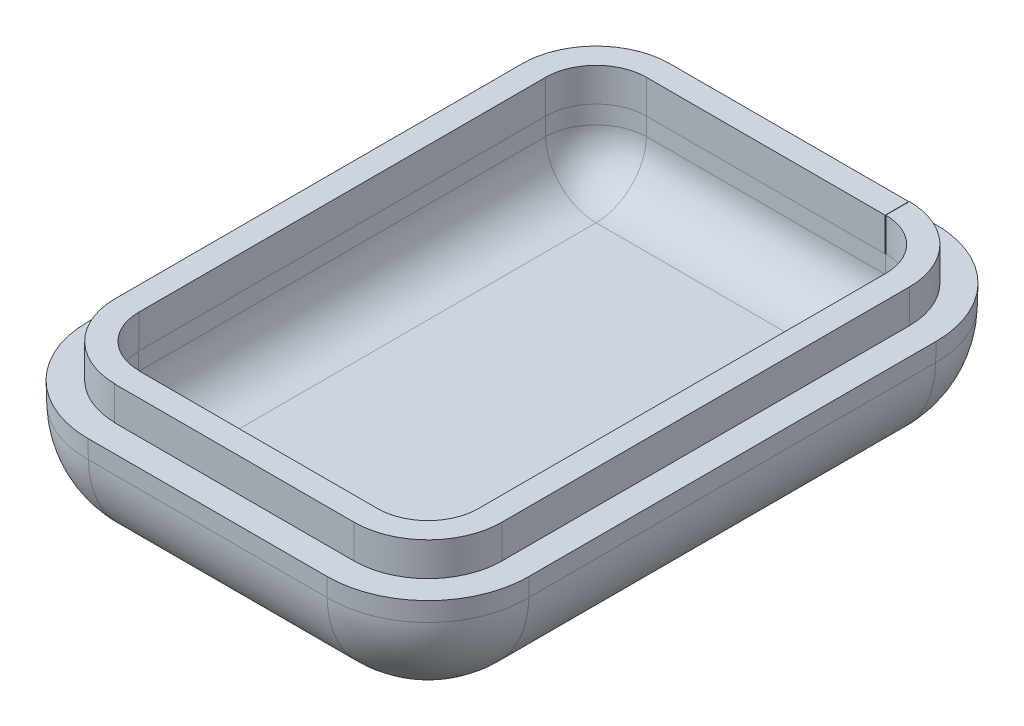
from build123d import *

# Parameters (mm, degrees)
SKETCH1_W           = 26
SKETCH1_H           = 36
BOSS_EXTRUDE1_DEPTH = 7
BOSS_EXTRUDE1_DRAFT = -1
FILLET1_R           = 6
SHELL1_T            = -3
EXTRUDE_THIN1_DEPTH = 2


# Read off the part's stored shape, not the designer's step: Extrude-Thin1
with BuildPart() as part:
    # Sketch1 → Boss-Extrude1 (with draft: the straight prism first)
    with BuildSketch(Plane(origin=(0, 0, 0), x_dir=(1, 0, 0), z_dir=(0, 1, 0))):
        Rectangle(SKETCH1_W, SKETCH1_H)
    extrude(amount=BOSS_EXTRUDE1_DEPTH)
    # Boss-Extrude1: the draft: its side faces are tilted about the plane it starts from
    boss_extrude1_sides = [part.faces().sort_by_distance(p)[0] for p in [
        (-13, 3.5, 0),
        (0, 3.5, 18),
        (13, 3.5, 0),
        (0, 3.5, -18),
    ]]
    draft(boss_extrude1_sides, Plane(origin=(0, 0, 0), x_dir=(1, 0, 0), z_dir=(0, 1, 0)), BOSS_EXTRUDE1_DRAFT)

    # Fillet1
    fillet1_edges = [part.edges().sort_by_distance(p)[0] for p in [
        (0, 0, 18),
        (-13, 0, 0),
        (0, 0, -18),
        (13, 0, 0),
        (13.061092727, 3.5, 18.061092727),
        (-13.061092727, 3.5, 18.061092727),
        (-13.061092727, 3.5, -18.061092727),
        (13.061092727, 3.5, -18.061092727),
    ]]
    fillet(fillet1_edges, radius=FILLET1_R)

    # Shell1
    shell1_openings = [part.faces().sort_by_distance(p)[0] for p in [
        (0, 7, 0),
    ]]
    offset(amount=SHELL1_T, openings=shell1_openings, kind=Kind.INTERSECTION)

    # Extrude-Thin1 outline → Extrude-Thin1 (add)
    with BuildSketch(Plane(origin=(0, 7, 0), x_dir=(1, 0, 0), z_dir=(0, 1, 0))):
        with BuildLine():
            Line((-11.503359551, 12.103816421), (-11.503359551, -12.103816421))
            add(Edge.make_bspline(
                [(-11.503359551, -12.103816421), (-11.503239974, -12.679639127), (-11.388644012, -13.255211042), (-10.94780799, -14.319148914), (-10.621742234, -14.807098768), (-9.807439748, -15.62148016), (-9.319521491, -15.947593193), (-8.261151516, -16.386242364), (-7.692017173, -16.500790934), (-7.122185385, -16.503316936)],
                knots=[0, 0, 0, 0, 0.25, 0.25, 0.5, 0.5, 0.75, 0.75, 0.997403327, 0.997403327, 0.997403327, 0.997403327], degree=3))
            Line((-7.122185385, -16.503316936), (-7.122185385, -16.52172847))
            Line((-7.122185385, -16.52172847), (7.122185385, -16.52172847))
            add(Edge.make_bspline(
                [(7.122185385, -16.52172847), (7.698092154, -16.52172847), (8.273773075, -16.407240069), (9.337918721, -15.966495827), (9.825962781, -15.640412314), (10.640412314, -14.825962781), (10.966495827, -14.337918721), (11.407240069, -13.273773075), (11.52172847, -12.698092154), (11.52172847, -12.122185385)],
                knots=[0, 0, 0, 0, 0.25, 0.25, 0.5, 0.5, 0.75, 0.75, 1, 1, 1, 1], degree=3))
            Line((11.52172847, -12.122185385), (11.52172847, 12.122185385))
            add(Edge.make_bspline(
                [(11.52172847, 12.122185385), (11.52172847, 12.698092154), (11.407240069, 13.273773075), (10.966495827, 14.337918721), (10.640412314, 14.825962781), (9.825962781, 15.640412314), (9.337918721, 15.966495827), (8.273773075, 16.407240069), (7.698092154, 16.52172847), (7.122185385, 16.52172847)],
                knots=[0, 0, 0, 0, 0.25, 0.25, 0.5, 0.5, 0.75, 0.75, 1, 1, 1, 1], degree=3))
            Line((7.122185385, 16.52172847), (7.122185385, 15.12172847))
            add(Edge.make_bspline(
                [(10.12172847, 12.122185385), (10.12172847, 15.12172847), (7.122185385, 15.12172847)],
                knots=[2.356346783, 2.356346783, 2.356346783, 3.926838524, 3.926838524, 3.926838524], degree=2, weights=[1, 0.707214461, 1]))
            Line((10.12172847, 12.122185385), (10.12172847, -12.122185385))
            add(Edge.make_bspline(
                [(7.122185385, -15.12172847), (10.12172847, -15.12172847), (10.12172847, -12.122185385)],
                knots=[2.356346783, 2.356346783, 2.356346783, 3.926838524, 3.926838524, 3.926838524], degree=2, weights=[1, 0.707214461, 1]))
            Line((7.122185385, -15.12172847), (-7.103822016, -15.12172847))
            Line((-7.103822016, -15.12172847), (-7.103816421, -15.103359507))
            add(Edge.make_bspline(
                [(-10.103359507, -12.103816421), (-10.102446165, -15.102446165), (-7.103816421, -15.103359507)],
                knots=[3.92714311, 3.92714311, 3.92714311, 5.497634851, 5.497634851, 5.497634851], degree=2, weights=[1, 0.707214461, 1]))
            Line((-10.103359507, -12.103816421), (-10.103359507, 12.103816421))
            add(Edge.make_bspline(
                [(-7.103816421, 15.103359507), (-10.102446165, 15.102446165), (-10.103359507, 12.103816421)],
                knots=[3.92714311, 3.92714311, 3.92714311, 5.497634851, 5.497634851, 5.497634851], degree=2, weights=[1, 0.707214461, 1]))
            Line((-7.103816421, 15.103359507), (7.103816421, 15.103359507))
            Line((7.103816421, 15.103359507), (7.103816421, 16.503359507))
            Line((7.103816421, 16.503359507), (-7.103816421, 16.503359551))
            add(Edge.make_bspline(
                [(-7.103816421, 16.503359551), (-7.679674662, 16.503239967), (-8.255282039, 16.388629695), (-9.319274889, 15.947740691), (-9.807244134, 15.621636328), (-10.621636328, 14.807244134), (-10.947740691, 14.319274889), (-11.388629695, 13.255282039), (-11.503239967, 12.679674662), (-11.503359551, 12.103816421)],
                knots=[0, 0, 0, 0, 0.25, 0.25, 0.5, 0.5, 0.75, 0.75, 1, 1, 1, 1], degree=3))
        make_face()
    extrude(amount=EXTRUDE_THIN1_DEPTH)


solid = part.part
